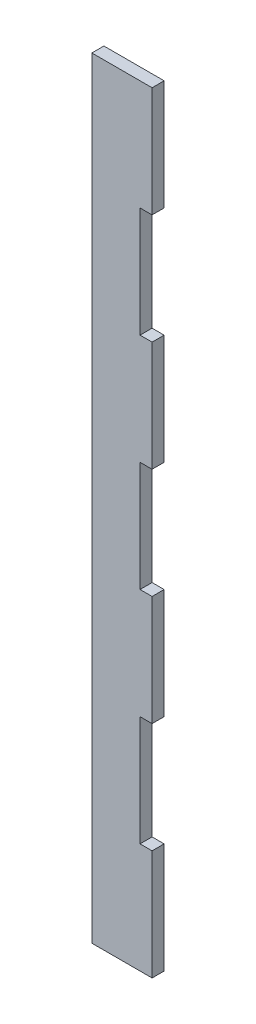
from build123d import *

# Parameters (mm, degrees)
BOSS_EXTRUDE1_DEPTH = 3.175


with BuildPart() as part:
    # Sketch1 → Boss-Extrude1 (new body)
    with BuildSketch(Plane.XY):
        Polygon((-6.35, 101.6), (-6.35, -101.6), (9.525, -101.6), (9.525, -72.571428571), (6.35, -72.571428571), (6.35, -43.542857143), (9.525, -43.542857143), (9.525, -14.514285714), (6.35, -14.514285714), (6.35, 14.514285714), (9.525, 14.514285714), (9.525, 43.542857143), (6.35, 43.542857143), (6.35, 72.571428571), (9.525, 72.571428571), (9.525, 101.6), align=None)
    extrude(amount=BOSS_EXTRUDE1_DEPTH)


solid = part.part
